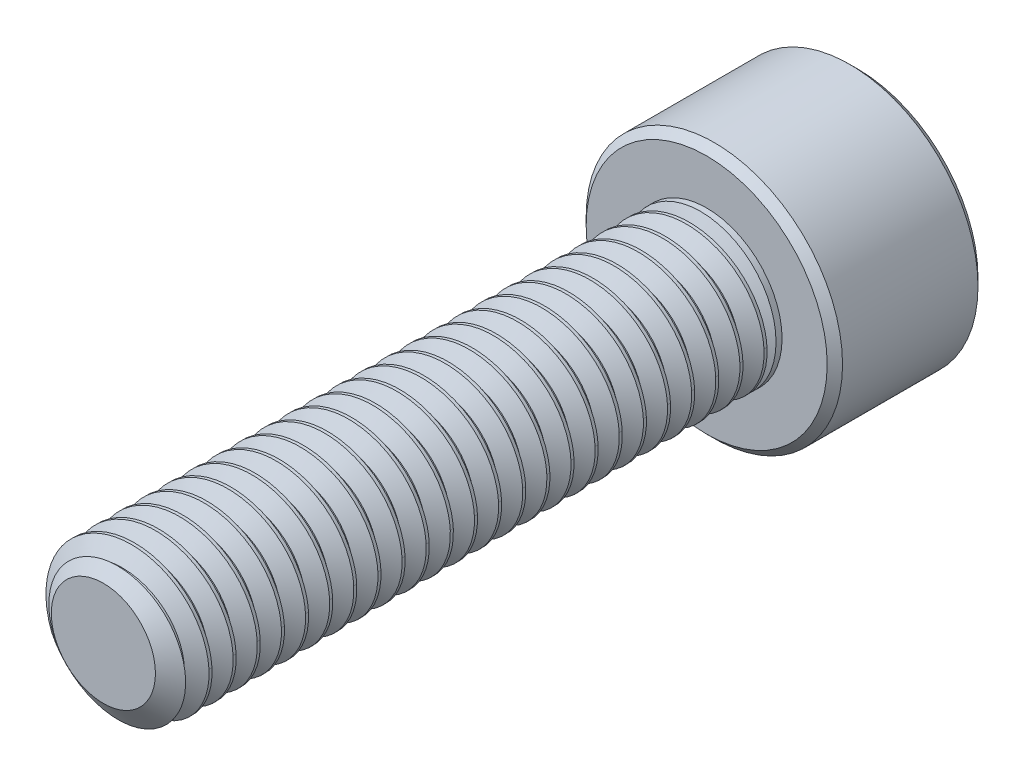
from build123d import *

# Parameters (mm, degrees)
SKETCH1_R          = 2.5
EXTRUDE1_DEPTH     = 20
CUT_SWEEP1_PITCH   = 0.8
SKETCH6_R          = 4.25
EXTRUDE2_DEPTH     = 5
CUT_EXTRUDE1_DEPTH = 3
CHAMFER1_SIZE      = 0.255


with BuildPart() as part:
    # Sketch1 → Extrude1 (new body)
    with BuildSketch(Plane.XY):
        Circle(SKETCH1_R)
    extrude(amount=-EXTRUDE1_DEPTH)

    # Cut-Sweep1: the profile of Sketch3 profile screwed along a right-hand helix of 26 turns, 6 arcs to a turn; built about Z, then put on its axis
    cut_sweep1_z = Axis((0, 0, 0), (0, 0, 1))
    cut_sweep1_corners = [(2.5003, 0, -0.700173205), (1.980384758, 0, -0.4), (1.980384758, 0, -0.3), (2.5003, 0, 0.000173205)]
    with BuildLine(mode=Mode.PRIVATE) as cut_sweep1_profile:
        Line(cut_sweep1_corners[0], cut_sweep1_corners[1])
        Line(cut_sweep1_corners[1], cut_sweep1_corners[2])
        Line(cut_sweep1_corners[2], cut_sweep1_corners[3])
        Line(cut_sweep1_corners[3], cut_sweep1_corners[0])
    cut_sweep1_cap = Face(cut_sweep1_profile.wire())
    cut_sweep1_turn_angles = [0, 30, 60, 90, 120, 150, 180, 210, 240, 270, 300, 330, 360]
    cut_sweep1_turn_weights = [1, 0.8660254037844387, 1, 0.8660254037844387, 1, 0.8660254037844387, 1, 0.8660254037844387, 1, 0.8660254037844387, 1, 0.8660254037844387, 1]
    cut_sweep1_turn_rails = [Edge.make_bspline([Vector(p[0], p[1], 0).rotate(cut_sweep1_z, cut_sweep1_turn_angles[k]) / cut_sweep1_turn_weights[k] + Vector(0, 0, p[2] + CUT_SWEEP1_PITCH * cut_sweep1_turn_angles[k] / 360) for k in range(13)], [0, 0, 0, 1, 1, 2, 2, 3, 3, 4, 4, 5, 5, 6, 6, 6], 2, cut_sweep1_turn_weights) for p in cut_sweep1_corners]
    cut_sweep1_turn_sides = [Face.make_surface_from_curves(cut_sweep1_turn_rails[p[0]], cut_sweep1_turn_rails[p[1]]) for p in [(0, 1), (1, 2), (2, 3), (3, 0)]]
    cut_sweep1 = Plane(origin=(0, 0, 0), x_dir=(0, 1, 0), z_dir=(0, 0, -1)) * Solid(Shell([*[p.moved(Location((0, 0, CUT_SWEEP1_PITCH * i))) for i in range(26) for p in cut_sweep1_turn_sides], cut_sweep1_cap, cut_sweep1_cap.rotate(cut_sweep1_z, 9360).moved(Location((0, 0, CUT_SWEEP1_PITCH * 9360 / 360)))]))
    add(cut_sweep1, mode=Mode.SUBTRACT)

    # Sketch4 → Cut-Revolve1 (revolve, cut)
    with BuildSketch(Plane(origin=(0, 0, 0), x_dir=(0, 0, -1), z_dir=(1, 0, 0)), mode=Mode.PRIVATE) as cut_revolve1_sk:
        Polygon((0.541691224, 2.5), (0, 1.726384758), (0, 2.5), align=None)
    revolve(cut_revolve1_sk.sketch.rotate(Axis((0, 0, 0), (0, 0, -1)), 260.43858876), axis=Axis((0, 0, 0), (0, 0, -1)), mode=Mode.SUBTRACT)

    # Sketch6 → Extrude2 (add)
    with BuildSketch(Plane(origin=(0, 0, -20), x_dir=(-1, 0, 0), z_dir=(0, 0, -1))):
        Circle(SKETCH6_R)
    extrude(amount=EXTRUDE2_DEPTH)

    # Sketch7 → Cut-Extrude1 (cut)
    with BuildSketch(Plane(origin=(0, 0, -25), x_dir=(-1, 0, 0), z_dir=(0, 0, -1))):
        Polygon((0, 2.309401077), (-2, 1.154700538), (-2, -1.154700538), (0, -2.309401077), (2, -1.154700538), (2, 1.154700538), align=None)
    extrude(amount=-CUT_EXTRUDE1_DEPTH, mode=Mode.SUBTRACT)

    # Cut-Extrude2 cone 1 section (through the dimple's axis) → Cut-Extrude2 (revolve, cut)
    with BuildSketch(Plane(origin=(0, 0, -25), x_dir=(0, 1, 0), z_dir=(1, 0, 0))):
        Polygon((0, 0), (2.309401077, 0), (0, 2.309401077), align=None)
    revolve(axis=Axis((0, 0, -25), (0, 0, 1)), mode=Mode.SUBTRACT)

    # Chamfer1
    chamfer1_edges = [part.edges().sort_by_distance(p)[0] for p in [
        (4.25, 0, -20),
        (4.25, 0, -25),
    ]]
    chamfer(chamfer1_edges, length=CHAMFER1_SIZE)

    # Sketch10 → Revolve1 (revolve)
    with BuildSketch(Plane(origin=(0, 0, 0), x_dir=(0, 0, -1), z_dir=(1, 0, 0)), mode=Mode.PRIVATE) as revolve1_sk:
        Polygon((20, 2.5), (20, 0), (18.764466094, 0), (19.8, 2.5), align=None)
    revolve(revolve1_sk.sketch.rotate(Axis((0, 0, -20), (0, 0, 1)), 270), axis=Axis((0, 0, -20), (0, 0, 1)))


solid = part.part
